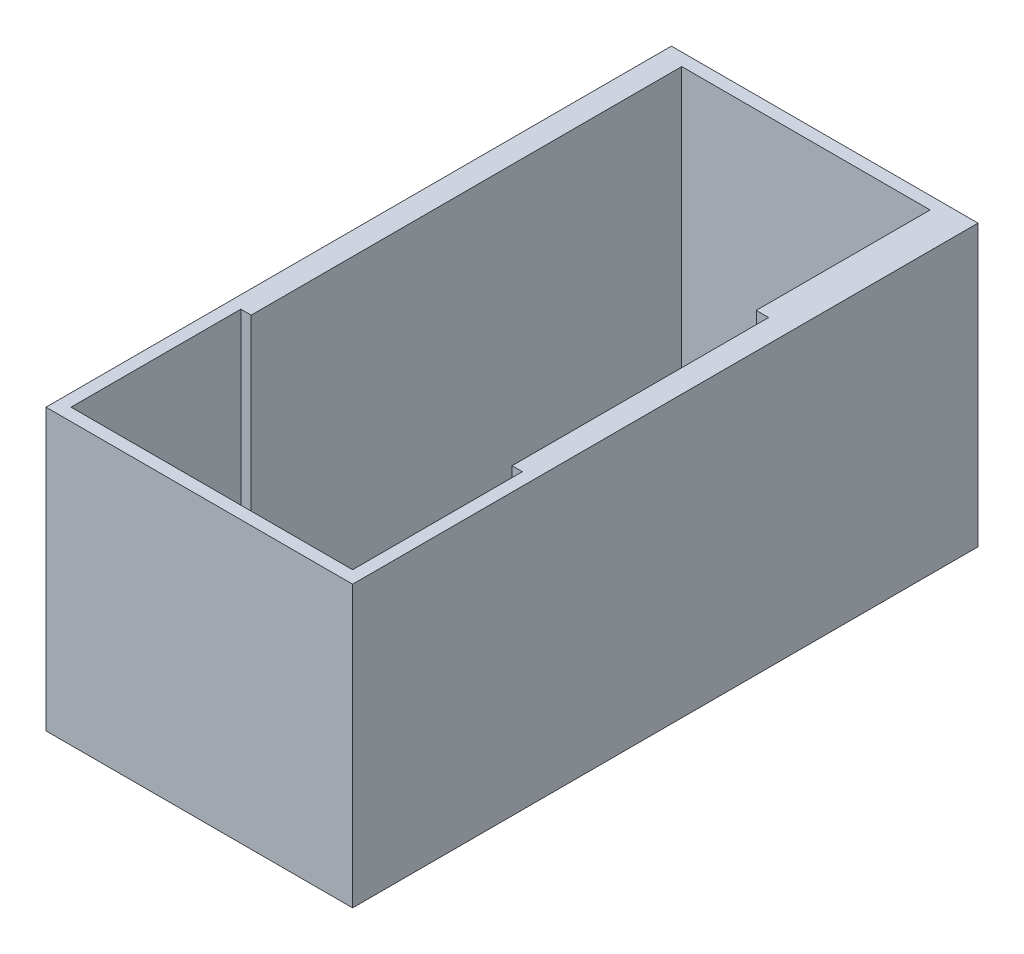
from build123d import *

# Parameters (mm, degrees)
SKETCH6_W           = 122.268
SKETCH6_H           = 249.395
BOSS_EXTRUDE1_DEPTH = 111.8


with BuildPart() as part:
    # Sketch6 → Boss-Extrude1 (new body)
    with BuildSketch(Plane(origin=(0, 0, 0), x_dir=(1, 0, 0), z_dir=(0, 1, 0))):
        with Locations((-748.0935, 3042.6025)):
            Rectangle(SKETCH6_W, SKETCH6_H)
        Polygon((-800.1, 3162.3), (-701.04, 3162.3), (-701.04, 3092.958), (-696.087, 3092.958), (-696.087, 2990.596), (-691.9595, 2990.596), (-691.9595, 2922.905), (-804.2275, 2922.905), (-804.2275, 2990.596), (-800.1, 2990.596), align=None, mode=Mode.SUBTRACT)
    extrude(amount=BOSS_EXTRUDE1_DEPTH)


solid = part.part
